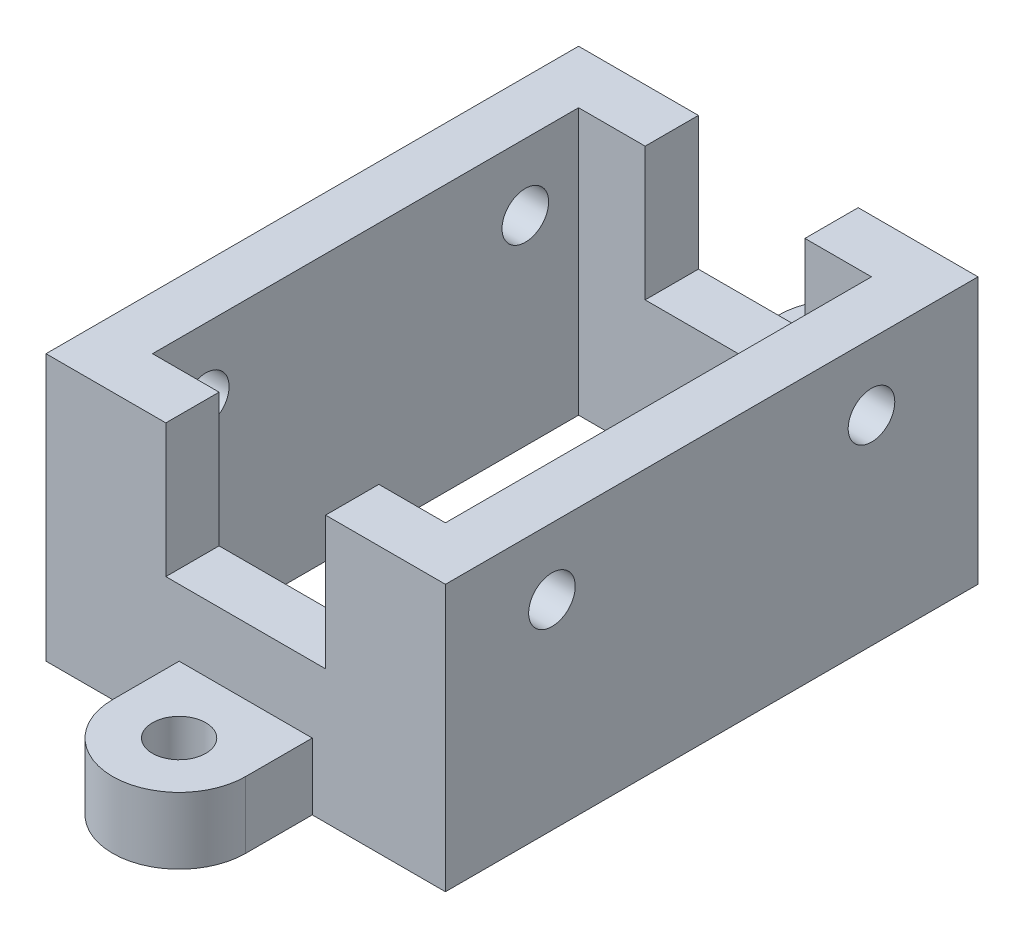
from build123d import *

# Parameters (mm, degrees)
ESBO_O1_W                = 30
ESBO_O1_H                = 40
ESBO_O1_W_2              = 22
ESBO_O1_H_2              = 32
RESSALTO_EXTRUS_O1_DEPTH = 20
ESBO_O2_W                = 12
ESBO_O2_H                = 85.17475125
CORTE_EXTRUS_O1_DEPTH    = 10
ESBO_O3_R                = 1.75
CORTE_EXTRUS_O2_DEPTH    = 42.231056256
ESBO_O4_R                = 2
RESSALTO_EXTRUS_O2_DEPTH = 5


with BuildPart() as part:
    # Esboço1 → Ressalto-extrusão1 (new body)
    with BuildSketch(Plane(origin=(0, 0, 0), x_dir=(1, 0, 0), z_dir=(0, 1, 0))):
        Rectangle(ESBO_O1_W, ESBO_O1_H)
        Rectangle(ESBO_O1_W_2, ESBO_O1_H_2, mode=Mode.SUBTRACT)
    extrude(amount=RESSALTO_EXTRUS_O1_DEPTH)

    # Esboço2 → Corte-extrusão1 (cut)
    with BuildSketch(Plane(origin=(0, 20, 0), x_dir=(1, 0, 0), z_dir=(0, 1, 0))):
        Rectangle(ESBO_O2_W, ESBO_O2_H)
    extrude(amount=-CORTE_EXTRUS_O1_DEPTH, mode=Mode.SUBTRACT)

    # Esboço3 → Corte-extrusão2 (cut, through all)
    with BuildSketch(Plane(origin=(15, 0, 0), x_dir=(0, 0, -1), z_dir=(1, 0, 0))):
        with Locations((-12, 15)):
            Circle(ESBO_O3_R)
        with Locations((12, 15)):
            Circle(ESBO_O3_R)
    extrude(amount=-CORTE_EXTRUS_O2_DEPTH, mode=Mode.SUBTRACT)

    # Esboço4 → Ressalto-extrusão2 (add)
    # profile 1 of 2: a face of its own
    with BuildSketch(Plane(origin=(0, 0, 0), x_dir=(1, 0, 0), z_dir=(0, 1, 0))):
        with BuildLine():
            Line((-5, 25), (-5, 20))
            Line((-5, 20), (5, 20))
            Line((5, 20), (5, 25))
            ThreePointArc((5, 25), (0, 30), (-5, 25))
        make_face()
        with Locations((0, 25)):
            Circle(ESBO_O4_R, mode=Mode.SUBTRACT)
    # profile 2 of 2: a face of its own
    with BuildSketch(Plane(origin=(0, 0, 0), x_dir=(1, 0, 0), z_dir=(0, 1, 0))):
        with BuildLine():
            Line((-5, -25), (-5, -20))
            Line((-5, -20), (5, -20))
            Line((5, -20), (5, -25))
            ThreePointArc((5, -25), (0, -30), (-5, -25))
        make_face()
        with Locations((0, -25)):
            Circle(ESBO_O4_R, mode=Mode.SUBTRACT)
    extrude(amount=RESSALTO_EXTRUS_O2_DEPTH)


solid = part.part
